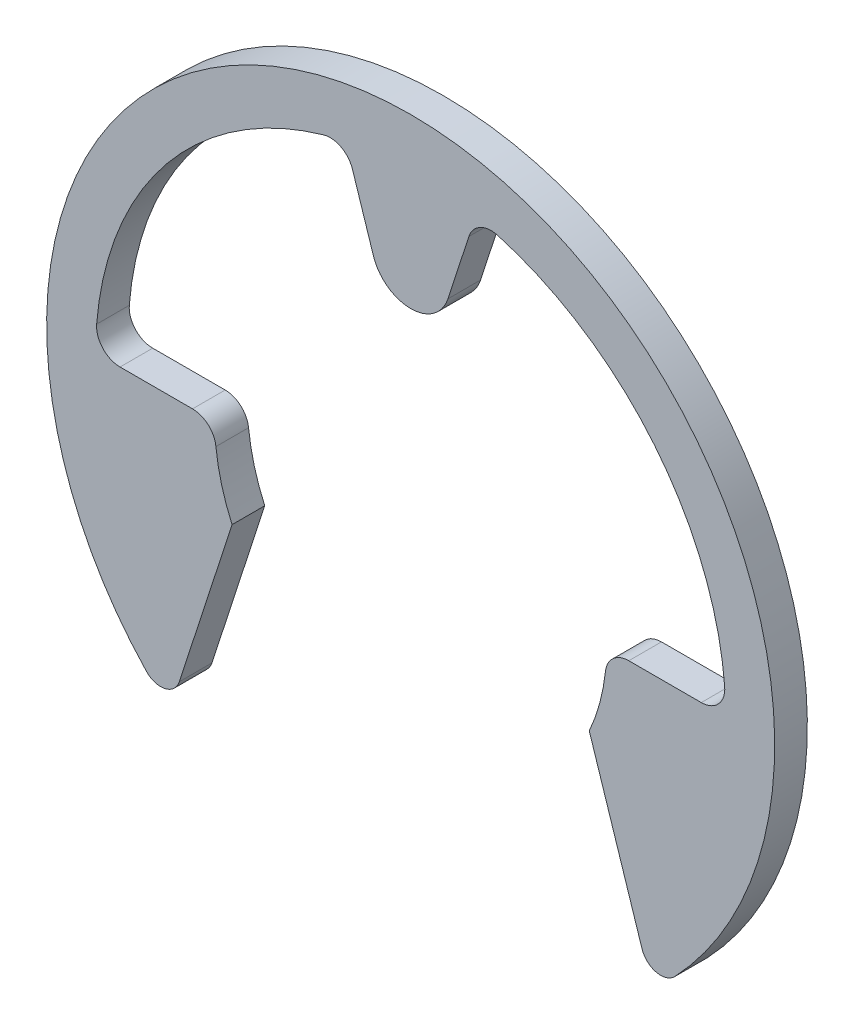
from build123d import *

# Parameters (mm, degrees)
BASEBODY_DEPTH = 2
FILLET1_R      = 1.44


with BuildPart() as part:
    # BodySke → BaseBody (new body)
    with BuildSketch(Plane.XY):
        with BuildLine():
            Line((10.94, -4.931166191), (14.174072778, -14.884618738))
            ThreePointArc((14.174072778, -14.884618738), (15.050904389, -15.684299729), (16.186355229, -15.339227634))
            ThreePointArc((16.186355229, -15.339227634), (0, 22.3), (-16.186355229, -15.339227634))
            ThreePointArc((-16.186355229, -15.339227634), (-15.050904389, -15.684299729), (-14.174072778, -14.884618738))
            Line((-14.174072778, -14.884618738), (-10.94, -4.931166191))
            ThreePointArc((-10.94, -4.931166191), (-11.732007501, -2.521904043), (-12, 0))
            Line((-12, 0), (-19.3, 0))
            ThreePointArc((-19.3, 0), (-14.988645278, 12.158557181), (-3.980775882, 18.885005252))
            Line((-3.980775882, 18.885005252), (-2.282535639, 13.658359214))
            ThreePointArc((-2.282535639, 13.658359214), (0, 12), (2.282535639, 13.658359214))
            Line((2.282535639, 13.658359214), (3.980775882, 18.885005252))
            ThreePointArc((3.980775882, 18.885005252), (14.988645278, 12.158557181), (19.3, 0))
            Line((19.3, 0), (12, 0))
            ThreePointArc((12, 0), (11.732007501, -2.521904043), (10.94, -4.931166191))
        make_face()
    extrude(amount=BASEBODY_DEPTH)

    # Fillet1
    fillet1_edges = [part.edges().sort_by_distance(p)[0] for p in [
        (19.3, 0, 1),
        (-19.3, 0, 1),
        (3.980775882, 18.885005252, 1),
        (-3.980775882, 18.885005252, 1),
        (12, 0, 1),
        (-12, 0, 1),
    ]]
    fillet(fillet1_edges, radius=FILLET1_R)


solid = part.part
